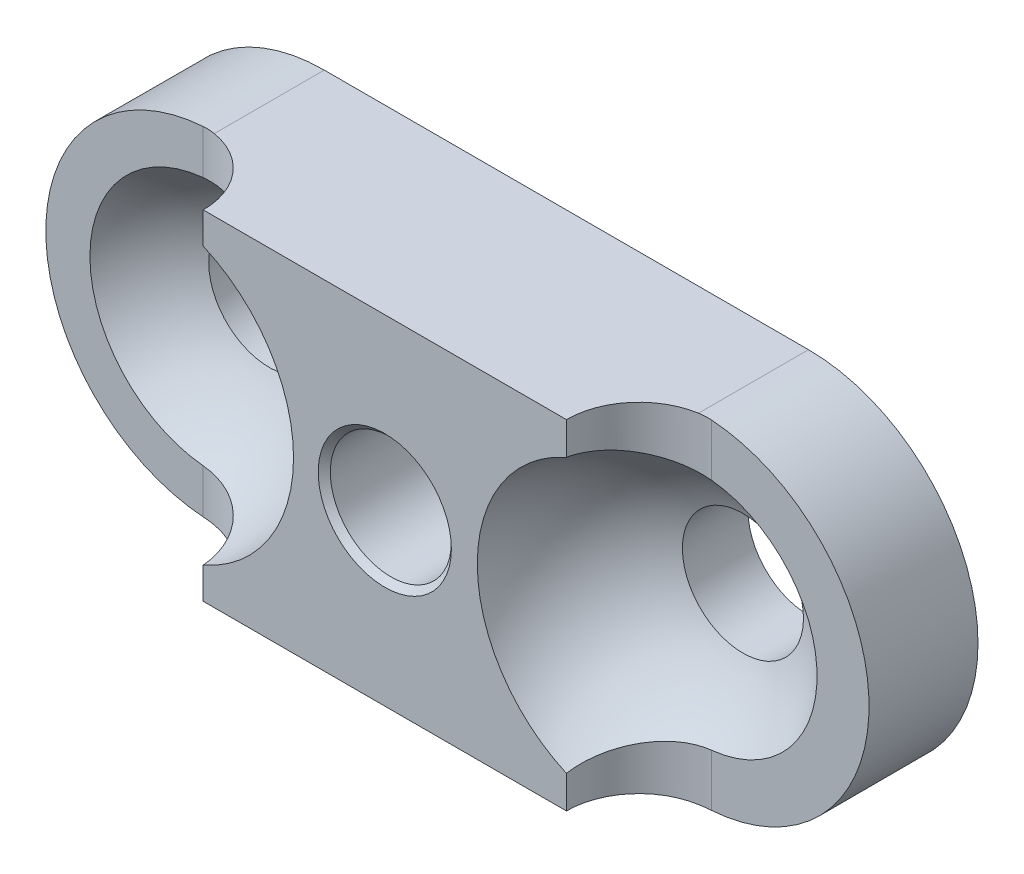
from build123d import *

# Parameters (mm, degrees)
BOSS_EXTRU_1_DEPTH           = 15
ENL_V_MAT_EXTRU_2_REACH      = 89.364
ENL_V_MAT_EXTRU_3_REACH      = 88.221
ESQUISSE8_R                  = 5
CHANFREIN1_SIZE              = 0.5
ENL_V_MAT_EXTRU_4_REACH      = 88.221
ENL_V_MAT_EXTRU_4_END_RADIUS = 12.5
ESQUISSE9_R                  = 5
SYM_TRIE2_OUTLINE_R          = 5
SYM_TRIE2_DEPTH              = 5.418281221


# Read off the part's stored shape, not the designer's step: Symétrie2
with BuildPart() as part:
    # Esquisse1 → Boss.-Extru.1 (new body)
    with BuildSketch(Plane.XY):
        with BuildLine():
            Line((-67.384328638, 24.199161074), (-27.384328638, 24.199161074))
            ThreePointArc((-27.384328638, 24.199161074), (-13.384328638, 10.199161074), (-27.384328638, -3.800838926))
            Line((-27.384328638, -3.800838926), (-67.384328638, -3.800838926))
            ThreePointArc((-67.384328638, -3.800838926), (-81.384328638, 10.199161074), (-67.384328638, 24.199161074))
        make_face()
    extrude(amount=BOSS_EXTRU_1_DEPTH)

    # Esquisse3 → Enlèvement de matière-Révolution1 (revolve, cut)
    with BuildSketch(Plane(origin=(0, 10.199161074, 0), x_dir=(-1, 0, 0), z_dir=(0, 1, 0))):
        with BuildLine():
            Line((67.384328638, 28.5), (67.384328638, 3.5))
            ThreePointArc((67.384328638, 3.5), (54.884328638, 16), (67.384328638, 28.5))
        make_face()
    revolve(axis=Axis((-67.384328638, 10.199161074, 28.5), (0, 0, -1)), mode=Mode.SUBTRACT)

    # Esquisse4 → Enlèvement de matière-Révolution2 (revolve, cut)
    with BuildSketch(Plane(origin=(0, 10.199161074, 0), x_dir=(-1, 0, 0), z_dir=(0, 1, 0))):
        with BuildLine():
            Line((27.384328638, 4.374720358), (27.384328638, 29.374720358))
            ThreePointArc((27.384328638, 29.374720358), (39.884328638, 16.874720358), (27.384328638, 4.374720358))
        make_face()
    revolve(axis=Axis((-27.384328638, 10.199161074, 4.374720358), (0, 0, 1)), mode=Mode.SUBTRACT)

    # Esquisse5 → Enlèv. mat.-Extru.2 (cut, up to next)
    with BuildSketch(Plane.XZ.offset(3.800838926), mode=Mode.PRIVATE) as enl_v_mat_extru_2_sk1:
        with BuildLine():
            Line((-63.278251084, 15), (-87.523217527, 15))
            Line((-87.523217527, 15), (-87.523217527, 9))
            Line((-87.523217527, 9), (-68.384328638, 9))
            ThreePointArc((-68.384328638, 9), (-64.141687951, 10.757359313), (-62.384328638, 15))
            Line((-62.384328638, 15), (-63.278251084, 15))
        make_face()
    enl_v_mat_extru_2_tool1 = extrude(enl_v_mat_extru_2_sk1.sketch, amount=-ENL_V_MAT_EXTRU_2_REACH, mode=Mode.PRIVATE) & part.part
    enl_v_mat_extru_2 = enl_v_mat_extru_2_tool1.solids().sort_by_distance((-75.559983, -3.800839, 12.089604))[0]
    add(enl_v_mat_extru_2, mode=Mode.SUBTRACT)

    # Symétrie1: Enlèv. mat.-Extru.2 mirrored; each copy of Enlèv. mat.-Extru.2 runs up to whatever stops it at its own place
    sym_trie1_before = part.part  # the part as the pattern finds it: every copy runs up to it
    sym_trie1_enl_v_mat_extru_2_long = extrude(enl_v_mat_extru_2_sk1.sketch, amount=-ENL_V_MAT_EXTRU_2_REACH, mode=Mode.PRIVATE)
    sym_trie1_enl_v_mat_extru_2_tool1 = sym_trie1_enl_v_mat_extru_2_long.mirror(Plane.ZY.offset(47.384328638)) & sym_trie1_before
    add(sym_trie1_enl_v_mat_extru_2_tool1.solids().sort_by_distance((-19.208674, -3.800839, 12.089604))[0], mode=Mode.SUBTRACT)

    # Esquisse8 → Enlèv. mat.-Extru.3 (cut, up to next)
    with BuildSketch(Plane.XY.offset(15), mode=Mode.PRIVATE) as enl_v_mat_extru_3_sk1:
        with Locations((-47.384328638, 10.199161074)):
            Circle(ESQUISSE8_R)
    enl_v_mat_extru_3_tool1 = extrude(enl_v_mat_extru_3_sk1.sketch, amount=-ENL_V_MAT_EXTRU_3_REACH, mode=Mode.PRIVATE) & part.part
    add(enl_v_mat_extru_3_tool1.solids().sort_by_distance((-47.384329, 10.199161, 15))[0], mode=Mode.SUBTRACT)

    # Chanfrein1
    chanfrein1_edges = [part.edges().sort_by_distance(p)[0] for p in [
        (-52.384328638, 10.199161074, 15),
        (-52.384328638, 10.199161074, 0),
    ]]
    chamfer(chanfrein1_edges, length=CHANFREIN1_SIZE)

    # Enlèv. mat.-Extru.4: up to this sphere (the profile starts outside it)
    enl_v_mat_extru_4_end = Location((-67.384328638, 10.199161074, 16)) * Sphere(ENL_V_MAT_EXTRU_4_END_RADIUS, mode=Mode.PRIVATE)
    # Esquisse9 → Enlèv. mat.-Extru.4 (cut, up to the surface)
    with BuildSketch(Plane(origin=(0, 0, 0), x_dir=(-1, 0, 0), z_dir=(0, 0, -1)), mode=Mode.PRIVATE) as enl_v_mat_extru_4_sk1:
        with Locations((67.384328638, 10.199161074)):
            Circle(ESQUISSE9_R)
    enl_v_mat_extru_4_tool1 = extrude(enl_v_mat_extru_4_sk1.sketch, amount=-ENL_V_MAT_EXTRU_4_REACH, mode=Mode.PRIVATE) - enl_v_mat_extru_4_end
    add(enl_v_mat_extru_4_tool1.solids().sort_by_distance((-67.384329, 10.199161, 0))[0], mode=Mode.SUBTRACT)

    # Symétrie2 outline → Symétrie2 (cut)
    with BuildSketch(Plane.XY):
        with Locations((-27.384328638, 10.199161074)):
            Circle(SYM_TRIE2_OUTLINE_R)
    extrude(amount=SYM_TRIE2_DEPTH, mode=Mode.SUBTRACT)


solid = part.part
